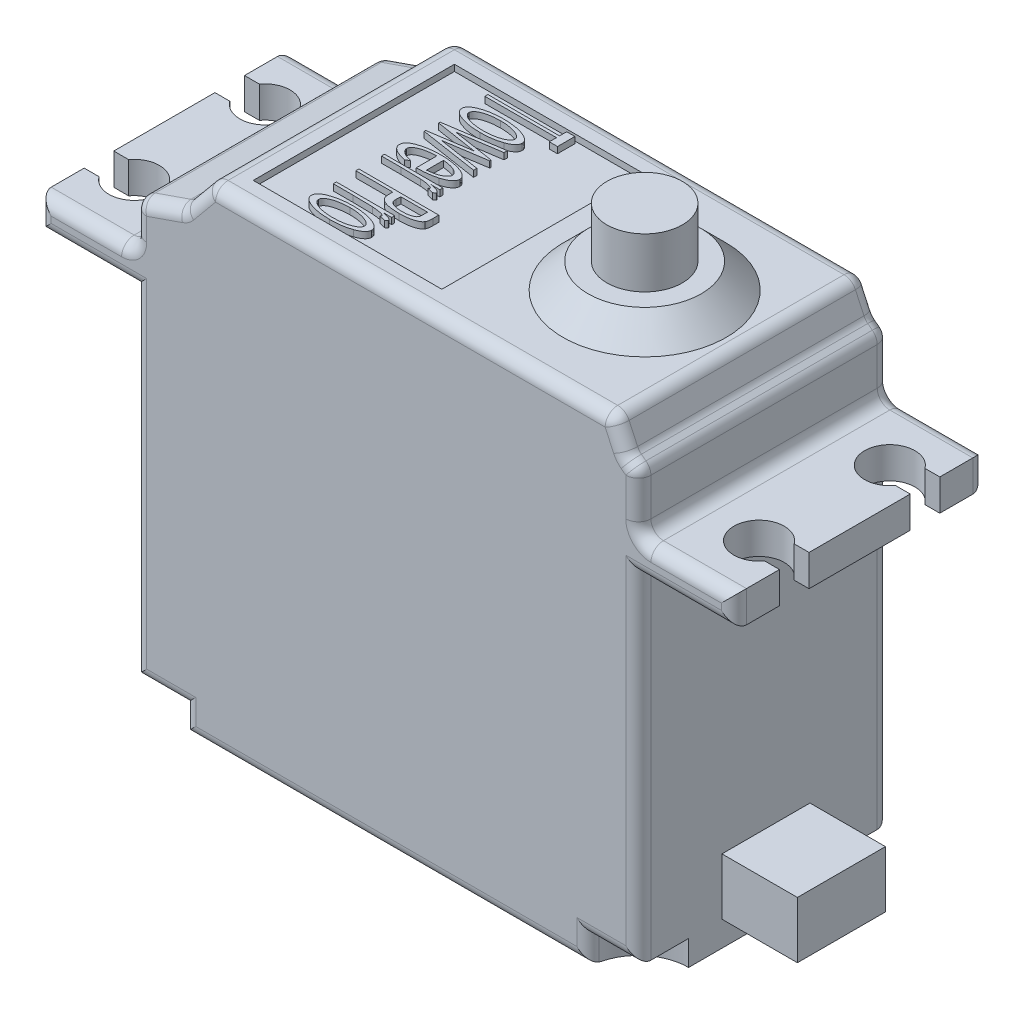
from build123d import *

# Parameters (mm, degrees)
SKETCH1_W                = 40.1
SKETCH1_H                = 20
BOSS_EXTRUDE1_DEPTH      = 38.9
SKETCH2_R                = 4
CUT_EXTRUDE1_DEPTH       = 2
SKETCH3_W                = 7
SKETCH3_H                = 4.5
BOSS_EXTRUDE2_DEPTH      = 6
BOSS_EXTRUDE3_DEPTH      = 7.6
BOSS_EXTRUDE3_DEPTH_BACK = 47.7
SKETCH4_W                = 20
SKETCH4_H                = 2.5
CUT_EXTRUDE6_DEPTH       = 3
CUT_EXTRUDE7_DEPTH       = 65.718621741
SKETCH7_R                = 6.5
BOSS_EXTRUDE4_DEPTH      = 2
SKETCH8_R                = 3
BOSS_EXTRUDE5_DEPTH      = 4
CHAMFER1_SIZE            = 2
FILLET1_R                = 1
SKETCH9_W                = 15
SKETCH9_H                = 16
CUT_EXTRUDE8_DEPTH       = 0.5
BOSS_EXTRUDE6_DEPTH      = 0.5


with BuildPart() as part:
    # Sketch1 → Boss-Extrude1 (new body)
    with BuildSketch(Plane(origin=(0, 0, 0), x_dir=(1, 0, 0), z_dir=(0, 1, 0))):
        with Locations((20.05, 10)):
            Rectangle(SKETCH1_W, SKETCH1_H)
    extrude(amount=BOSS_EXTRUDE1_DEPTH)

    # Sketch2 → Cut-Extrude1 (cut)
    with BuildSketch(Plane.XZ):
        with Locations((0, -20)):
            Circle(SKETCH2_R)
        Circle(SKETCH2_R)
        with Locations((40.1, 0)):
            Circle(SKETCH2_R)
        with Locations((40.1, -20)):
            Circle(SKETCH2_R)
    extrude(amount=-CUT_EXTRUDE1_DEPTH, mode=Mode.SUBTRACT)

    # Sketch3 → Boss-Extrude2 (add)
    with BuildSketch(Plane(origin=(40.1, 0, 0), x_dir=(0, 0, -1), z_dir=(1, 0, 0))):
        with Locations((10.15, 4.25)):
            Rectangle(SKETCH3_W, SKETCH3_H)
    extrude(amount=BOSS_EXTRUDE2_DEPTH)

    # Sketch4 → Boss-Extrude3 (add, two sides: drawn at the far end of the back side and taken through both)
    with BuildSketch(Plane(origin=(40.1, 0, 0), x_dir=(0, 0, -1), z_dir=(1, 0, 0)).offset(-BOSS_EXTRUDE3_DEPTH_BACK)):
        with Locations((10, 30.15)):
            Rectangle(SKETCH4_W, SKETCH4_H)
    extrude(amount=BOSS_EXTRUDE3_DEPTH + BOSS_EXTRUDE3_DEPTH_BACK)

    # Sketch5 → Cut-Extrude6 (cut)
    with BuildSketch(Plane(origin=(0, 31.4, 0), x_dir=(1, 0, 0), z_dir=(0, 1, 0))):
        with BuildLine():
            Line((-6.417379657, 5.976470588), (-7.6, 5.976470588))
            Line((-7.6, 5.976470588), (-7.6, 3.623529412))
            Line((-7.6, 3.623529412), (-6.417379657, 3.623529412))
            ThreePointArc((-6.417379657, 3.623529412), (-2.8, 4.8), (-6.417379657, 5.976470588))
        make_face()
        with BuildLine():
            Line((-7.6, 16.376470588), (-7.6, 14.023529412))
            Line((-7.6, 14.023529412), (-6.417379657, 14.023529412))
            ThreePointArc((-6.417379657, 14.023529412), (-2.8, 15.2), (-6.417379657, 16.376470588))
            Line((-6.417379657, 16.376470588), (-7.6, 16.376470588))
        make_face()
        with BuildLine():
            ThreePointArc((46.517379657, 14.023529412), (42.9, 15.2), (46.517379657, 16.376470588))
            Line((46.517379657, 16.376470588), (47.7, 16.376470588))
            Line((47.7, 16.376470588), (47.7, 14.023529412))
            Line((47.7, 14.023529412), (46.517379657, 14.023529412))
        make_face()
        with BuildLine():
            Line((47.7, 5.976470588), (46.517379657, 5.976470588))
            ThreePointArc((46.517379657, 5.976470588), (42.9, 4.8), (46.517379657, 3.623529412))
            Line((46.517379657, 3.623529412), (47.7, 3.623529412))
            Line((47.7, 3.623529412), (47.7, 5.976470588))
        make_face()
    extrude(amount=-CUT_EXTRUDE6_DEPTH, mode=Mode.SUBTRACT)

    # Sketch6 → Cut-Extrude7 (cut, through all)
    with BuildSketch(Plane.XY):
        Polygon((40.1, 38.9), (40.1, 35.9), (39.146440586, 36.628508369), (38.1, 38.9), align=None)
        Polygon((0, 38.9), (0, 34.9), (3.778086354, 36.213797359), (6, 38.9), align=None)
    extrude(amount=-CUT_EXTRUDE7_DEPTH, mode=Mode.SUBTRACT)

    # Sketch7 → Boss-Extrude4 (add)
    with BuildSketch(Plane(origin=(0, 38.9, 0), x_dir=(-1, 0, 0), z_dir=(0, 1, 0))):
        with Locations(Location((-30.6, -10, 0), (0, 0, 270))):
            Circle(SKETCH7_R)
    extrude(amount=BOSS_EXTRUDE4_DEPTH)

    # Sketch8 → Boss-Extrude5 (add)
    with BuildSketch(Plane(origin=(0, 40.9, 0), x_dir=(-1, 0, 0), z_dir=(0, 1, 0))):
        with Locations(Location((-30.6, -10, 0), (0, 0, 90))):
            Circle(SKETCH8_R)
    extrude(amount=BOSS_EXTRUDE5_DEPTH)

    # Chamfer1
    chamfer1_edges = [part.edges().sort_by_distance(p)[0] for p in [
        (30.6, 40.9, -3.5),
    ]]
    chamfer(chamfer1_edges, length=CHAMFER1_SIZE - 0.0001)  # a hair under: the kernel refuses the full size

    # Fillet1
    fillet1_edges = [part.edges().sort_by_distance(p)[0] for p in [
        (2, 2, -20),
        (4, 1, -20),
        (22.05, 38.9, -20),
        (40.1, 33.65, -20),
        (40.1, 33.65, 0),
        (38.1, 38.9, -10),
        (39.623220293, 36.264254185, -20),
        (40.1, 35.9, -10),
        (38.623220293, 37.764254185, -20),
        (39.146440586, 36.628508369, -10),
        (38.623220293, 37.764254185, 0),
        (39.623220293, 36.264254185, 0),
        (22.05, 38.9, 0),
        (0, 33.15, -20),
        (0, 33.15, 0),
        (4.889043177, 37.556898679, -20),
        (6, 38.9, -10),
        (1.889043177, 35.556898679, -20),
        (3.778086354, 36.213797359, -10),
        (0, 34.9, -10),
        (1.889043177, 35.556898679, 0),
        (4.889043177, 37.556898679, 0),
        (20.05, 0, 0),
        (2, 2, 0),
        (4, 1, 0),
        (36.1, 1, 0),
        (38.1, 2, 0),
        (20.05, 0, -20),
        (38.1, 2, -20),
        (36.1, 1, -20),
        (0, 15.45, -20),
        (40.1, 15.45, -20),
        (40.1, 15.45, 0),
        (0, 15.45, 0),
        (43.9, 28.9, 0),
        (-7.6, 30.15, 0),
        (-3.8, 28.9, 0),
        (43.9, 31.4, -20),
        (-7.6, 30.15, -20),
        (-3.8, 31.4, -20),
        (43.9, 31.4, 0),
        (-3.8, 31.4, 0),
        (43.9, 28.9, -20),
        (-3.8, 28.9, -20),
        (40.1, 31.4, -10),
        (0, 31.4, -10),
        (47.7, 30.15, 0),
        (47.7, 30.15, -20),
    ]]
    fillet(fillet1_edges, radius=FILLET1_R)

    # Sketch9 → Cut-Extrude8 (cut)
    with BuildSketch(Plane(origin=(0, 38.9, 0), x_dir=(-1, 0, 0), z_dir=(0, 1, 0))):
        with Locations((-14.970605647, -10)):
            Rectangle(SKETCH9_W, SKETCH9_H)
    extrude(amount=-CUT_EXTRUDE8_DEPTH, mode=Mode.SUBTRACT)

    # Sketch10 → Boss-Extrude6 (add)
    # profile 1 of 8: a face of its own
    with BuildSketch(Plane(origin=(0, 38.4, 0), x_dir=(-1, 0, 0), z_dir=(0, 1, 0))):
        with BuildLine():
            add(Edge.make_bspline(
                [(-15.609067185, -3.282381811), (-15.607111828, -3.248087251), (-15.603180704, -3.179140175), (-15.562474756, -3.080168118), (-15.501777128, -2.986177634), (-15.416386919, -2.897141186), (-15.307255469, -2.814010785), (-15.174481142, -2.735414592), (-15.018872121, -2.660118154), (-14.904772124, -2.617806185), (-14.844573996, -2.595482772)],
                knots=[0, 0, 0, 0, 0.750480752, 1.508794822, 2.318163911, 3.201857602, 4.205066968, 5.325788068, 6.589109935, 8, 8, 8, 8], degree=3))
            add(Edge.make_bspline(
                [(-14.844573996, -2.595482772), (-14.785454317, -2.57517579), (-14.665320573, -2.533911122), (-14.478143682, -2.486293662), (-14.284289647, -2.441479795), (-14.081425891, -2.408515746), (-13.871178797, -2.379717037), (-13.652516569, -2.361340803), (-13.426387932, -2.34951515), (-13.272778222, -2.348136337), (-13.194744268, -2.347435897)],
                knots=[0, 0, 0, 0, 0.894575042, 1.817815181, 2.763338534, 3.742370873, 4.758890728, 5.800938078, 6.882873379, 8, 8, 8, 8], degree=3))
            add(Edge.make_bspline(
                [(-13.194744268, -2.347435897), (-13.116282978, -2.348030617), (-12.961796706, -2.349201589), (-12.733963447, -2.362565138), (-12.513341359, -2.382826806), (-12.300136066, -2.410149605), (-12.094280592, -2.447291548), (-11.896490423, -2.49284771), (-11.705998004, -2.546685139), (-11.525231618, -2.606411463), (-11.358875094, -2.672144622), (-11.212685063, -2.744586255), (-11.088628134, -2.821602449), (-10.986211468, -2.903356488), (-10.90536203, -2.990063741), (-10.848111849, -3.082902695), (-10.812634271, -3.181106494), (-10.808120713, -3.248604656), (-10.805862057, -3.282381811)],
                knots=[0, 0, 0, 0, 1.371178853, 2.699781079, 3.987321504, 5.242966159, 6.455306528, 7.641775897, 8.789015155, 9.913895999, 10.968029035, 11.912579446, 12.761755319, 13.515219379, 14.197174364, 14.822498627, 15.410759582, 16, 16, 16, 16], degree=3))
            add(Edge.make_bspline(
                [(-10.805862057, -3.282381811), (-10.808173485, -3.316142765), (-10.812819984, -3.384010023), (-10.847790699, -3.482815117), (-10.905349887, -3.576019357), (-10.986592782, -3.662624766), (-11.08814888, -3.745873453), (-11.212764119, -3.822623466), (-11.358849826, -3.895195936), (-11.525240651, -3.960877852), (-11.705989714, -4.020661909), (-11.896514885, -4.074317364), (-12.094115157, -4.120553844), (-12.300406797, -4.154996776), (-12.513199043, -4.185077469), (-12.733987489, -4.204574844), (-12.961790389, -4.218150167), (-13.11628085, -4.219291917), (-13.194744268, -4.219871795)],
                knots=[0, 0, 0, 0, 0.588821408, 1.18366601, 1.808545603, 2.490015648, 3.247627414, 4.096199436, 5.040078174, 6.093461613, 7.21754255, 8.363966004, 9.549591671, 10.759779098, 12.015513892, 13.302138743, 14.629796197, 16, 16, 16, 16], degree=3))
            add(Edge.make_bspline(
                [(-13.194744268, -4.219871795), (-13.272354444, -4.219168131), (-13.425540578, -4.217779247), (-13.6512401, -4.205931046), (-13.869084516, -4.1877886), (-14.07843459, -4.158587801), (-14.280852461, -4.125645206), (-14.474850878, -4.081414585), (-14.661862289, -4.033147717), (-14.781628342, -3.992093665), (-14.84075789, -3.97182492)],
                knots=[0, 0, 0, 0, 1.113568755, 2.197950074, 3.242353264, 4.24910948, 5.230355196, 6.183954623, 7.10340252, 8, 8, 8, 8], degree=3))
            add(Edge.make_bspline(
                [(-14.84075789, -3.97182492), (-14.901393721, -3.949539572), (-15.015991025, -3.907421888), (-15.17250957, -3.831728784), (-15.305529525, -3.752337848), (-15.415085221, -3.668471114), (-15.501779186, -3.580279596), (-15.562776885, -3.485536674), (-15.602996253, -3.385971504), (-15.607058308, -3.316659734), (-15.609067185, -3.282381811)],
                knots=[0, 0, 0, 0, 1.41310997, 2.670674897, 3.799029526, 4.797667281, 5.683722785, 6.48940359, 7.252939179, 8, 8, 8, 8], degree=3))
        make_face()
        with BuildLine():
            add(Edge.make_bspline(
                [(-15.03919539, -3.283653846), (-15.037385907, -3.307211446), (-15.033727635, -3.354838373), (-15.006180955, -3.423795429), (-14.963532146, -3.489575561), (-14.90220099, -3.551211589), (-14.826272056, -3.612089833), (-14.732026772, -3.668760257), (-14.621852571, -3.723529242), (-14.496291015, -3.774568845), (-14.358383528, -3.820651751), (-14.21271031, -3.863278043), (-14.059030149, -3.896641369), (-13.899317401, -3.926793795), (-13.731824223, -3.947256694), (-13.558016644, -3.9646967), (-13.37671988, -3.972805412), (-13.253686576, -3.974683186), (-13.190928163, -3.975641026)],
                knots=[0, 0, 0, 0, 0.537020026, 1.085705432, 1.674077074, 2.318023423, 3.062261223, 3.892877357, 4.824182514, 5.871018303, 6.985945448, 8.144773651, 9.336135426, 10.57672083, 11.856208973, 13.189133643, 14.566197051, 16, 16, 16, 16], degree=3))
            add(Edge.make_bspline(
                [(-13.190928163, -3.975641026), (-13.109919995, -3.974210131), (-12.950281871, -3.971390351), (-12.714924833, -3.955370233), (-12.488222503, -3.925812746), (-12.272767487, -3.886025286), (-12.073501808, -3.835789358), (-11.895335599, -3.778344217), (-11.740801722, -3.712733461), (-11.611910878, -3.638356779), (-11.508388691, -3.55788316), (-11.433708833, -3.471409403), (-11.383671863, -3.380063249), (-11.378327872, -3.315158957), (-11.375733852, -3.283653846)],
                knots=[0, 0, 0, 0, 1.406122645, 2.770964778, 4.091824399, 5.37212343, 6.571589075, 7.656092665, 8.618568693, 9.479395674, 10.233363803, 10.880738082, 11.456700471, 12, 12, 12, 12], degree=3))
            add(Edge.make_bspline(
                [(-11.375733852, -3.283653846), (-11.378343531, -3.25216234), (-11.383719783, -3.187286078), (-11.433335545, -3.096000379), (-11.508910122, -3.01073381), (-11.611791957, -2.930073706), (-11.741128619, -2.856131531), (-11.894970497, -2.788564151), (-12.073565519, -2.731659892), (-12.272748381, -2.681239956), (-12.48822794, -2.641507026), (-12.714923311, -2.611934077), (-12.950282271, -2.595918229), (-13.109920129, -2.593097859), (-13.190928163, -2.591666667)],
                knots=[0, 0, 0, 0, 0.543418984, 1.11950801, 1.761435781, 2.515569685, 3.376585936, 4.342223991, 5.426966031, 6.626695402, 7.907275932, 9.22842597, 10.593568191, 12, 12, 12, 12], degree=3))
            add(Edge.make_bspline(
                [(-13.190928163, -2.591666667), (-13.253686884, -2.592623254), (-13.376720792, -2.594498573), (-13.558013209, -2.602624948), (-13.731836451, -2.620001318), (-13.899274292, -2.640689045), (-14.05927644, -2.670061522), (-14.21224153, -2.706244597), (-14.358914546, -2.745775183), (-14.496003698, -2.794466874), (-14.621857847, -2.844971216), (-14.732123534, -2.899720467), (-14.825716068, -2.956743798), (-14.903074469, -3.015984023), (-14.963141585, -3.078992907), (-15.005887611, -3.144439711), (-15.03391491, -3.212819728), (-15.037438082, -3.260080723), (-15.03919539, -3.283653846)],
                knots=[0, 0, 0, 0, 1.434283005, 2.81180747, 4.14517842, 5.425094952, 6.66609572, 7.860020677, 9.016601871, 10.135054363, 11.182240647, 12.113857616, 12.944751851, 13.683224851, 14.334416733, 14.92298537, 15.462800173, 16, 16, 16, 16], degree=3))
        make_face(mode=Mode.SUBTRACT)
    # profile 2 of 8: a face of its own
    with BuildSketch(Plane(origin=(0, 38.4, 0), x_dir=(-1, 0, 0), z_dir=(0, 1, 0))):
        with BuildLine():
            Line((-15.527656929, -5.196794872), (-15.527656929, -4.952564103))
            Line((-15.527656929, -4.952564103), (-14.844573996, -4.952564103))
            add(Edge.make_bspline(
                [(-14.844573996, -4.952564103), (-14.90748533, -4.940551424), (-15.024555176, -4.918197386), (-15.184685319, -4.876989103), (-15.317810816, -4.837539128), (-15.423619837, -4.795936855), (-15.504746915, -4.752960429), (-15.561945632, -4.708956082), (-15.600810781, -4.663011533), (-15.606466712, -4.628704369), (-15.609067185, -4.612930689)],
                knots=[0, 0, 0, 0, 1.761421786, 3.277777876, 4.5469885, 5.578007716, 6.402796696, 7.058594708, 7.567162562, 8, 8, 8, 8], degree=3))
            add(Edge.make_bspline(
                [(-15.609067185, -4.612930689), (-15.606571231, -4.600650718), (-15.600902797, -4.572762301), (-15.567012983, -4.535321924), (-15.515626773, -4.49906782), (-15.4737339, -4.476726365), (-15.450062778, -4.464102564)],
                knots=[0, 0, 0, 0, 0.654873348, 1.487249584, 2.580197173, 4, 4, 4, 4], degree=3))
            Line((-15.450062778, -4.464102564), (-14.956513099, -4.583673878))
            add(Edge.make_bspline(
                [(-14.956513099, -4.583673878), (-14.968584158, -4.591066235), (-14.990453206, -4.604458911), (-15.016708179, -4.625231732), (-15.03507124, -4.644666474), (-15.037952916, -4.65893295), (-15.03919539, -4.665084135)],
                knots=[0, 0, 0, 0, 1.415327194, 2.564137706, 3.380908414, 4, 4, 4, 4], degree=3))
            add(Edge.make_bspline(
                [(-15.03919539, -4.665084135), (-15.035215152, -4.6785491), (-15.025462266, -4.711542667), (-14.971084434, -4.747383694), (-14.895160342, -4.783701247), (-14.787161668, -4.81996478), (-14.647184039, -4.852022493), (-14.474124484, -4.880276957), (-14.267953232, -4.905759863), (-14.119155169, -4.917182784), (-14.039375679, -4.923307292)],
                knots=[0, 0, 0, 0, 0.309315145, 0.757923238, 1.387274804, 2.237985719, 3.310724258, 4.63114783, 6.193758007, 8, 8, 8, 8], degree=3))
            add(Edge.make_bspline(
                [(-14.039375679, -4.923307292), (-14.002490685, -4.925500119), (-13.91984389, -4.930413502), (-13.783738739, -4.936695447), (-13.622173419, -4.941727826), (-13.436008066, -4.94499488), (-13.22401538, -4.949282728), (-12.987407028, -4.951531822), (-12.725364902, -4.952864089), (-12.542614403, -4.952667294), (-12.446787538, -4.952564103)],
                knots=[0, 0, 0, 0, 0.556652875, 1.247270789, 2.052535074, 2.991732549, 4.052275248, 5.24685625, 6.556364347, 8, 8, 8, 8], degree=3))
            Line((-12.446787538, -4.952564103), (-10.887272313, -4.952564103))
            Line((-10.887272313, -4.952564103), (-10.887272313, -5.196794872))
            Line((-10.887272313, -5.196794872), (-15.527656929, -5.196794872))
        make_face()
    # profile 3 of 8: a face of its own
    with BuildSketch(Plane(origin=(0, 38.4, 0), x_dir=(-1, 0, 0), z_dir=(0, 1, 0))):
        with BuildLine():
            Line((-17.237272313, -6.987820513), (-17.237272313, -6.520983574))
            add(Edge.make_bspline(
                [(-17.237272313, -6.520983574), (-17.236247088, -6.459405423), (-17.234368154, -6.346550872), (-17.2168055, -6.194357629), (-17.191831076, -6.071672753), (-17.157160159, -6.007429133), (-17.141869669, -5.979096554)],
                knots=[0, 0, 0, 0, 1.327150313, 2.432274264, 3.308605093, 4, 4, 4, 4], degree=3))
            add(Edge.make_bspline(
                [(-17.141869669, -5.979096554), (-17.114760792, -5.945957077), (-17.056002246, -5.874127192), (-16.930847731, -5.788130336), (-16.772349287, -5.712605889), (-16.580994243, -5.644849151), (-16.358143815, -5.590303655), (-16.10722884, -5.54993826), (-15.829593486, -5.526077812), (-15.635404971, -5.523685138), (-15.534017105, -5.522435897)],
                knots=[0, 0, 0, 0, 0.594983836, 1.289628702, 2.093972417, 3.04272691, 4.11602617, 5.290956585, 6.585579944, 8, 8, 8, 8], degree=3))
            add(Edge.make_bspline(
                [(-15.534017105, -5.522435897), (-15.432214779, -5.523807648), (-15.23765631, -5.526429256), (-14.959572202, -5.548585873), (-14.709638056, -5.587886564), (-14.487887919, -5.639864533), (-14.296809846, -5.70619678), (-14.137873348, -5.784195511), (-14.010923963, -5.875025169), (-13.950657591, -5.950162284), (-13.922348435, -5.985456731)],
                knots=[0, 0, 0, 0, 1.412847374, 2.700148731, 3.867951888, 4.921354973, 5.857592027, 6.668210199, 7.374413232, 8, 8, 8, 8], degree=3))
            add(Edge.make_bspline(
                [(-13.922348435, -5.985456731), (-13.905759573, -6.017170889), (-13.868215297, -6.088947066), (-13.839291883, -6.222903253), (-13.820680929, -6.388520412), (-13.818975254, -6.510293115), (-13.818041544, -6.576953125)],
                knots=[0, 0, 0, 0, 0.704794633, 1.595106667, 2.683529165, 4, 4, 4, 4], degree=3))
            Line((-13.818041544, -6.576953125), (-13.818041544, -6.743589744))
            Line((-13.818041544, -6.743589744), (-10.887272313, -6.743589744))
            Line((-10.887272313, -6.743589744), (-10.887272313, -6.987820513))
            Line((-10.887272313, -6.987820513), (-17.237272313, -6.987820513))
        make_face()
        with BuildLine():
            Line((-16.585990262, -6.743589744), (-14.469323595, -6.743589744))
            Line((-14.469323595, -6.743589744), (-14.455331208, -6.351802885))
            add(Edge.make_bspline(
                [(-14.455331208, -6.351802885), (-14.456743429, -6.314813863), (-14.459401008, -6.245206348), (-14.480207087, -6.148072256), (-14.517591122, -6.066755185), (-14.570681035, -5.999585651), (-14.642005848, -5.947674265), (-14.727028876, -5.899075766), (-14.832233469, -5.862012107), (-14.951974063, -5.827828954), (-15.084657529, -5.800444948), (-15.226501246, -5.780110098), (-15.376522395, -5.768773541), (-15.478877129, -5.767381817), (-15.531473034, -5.766666667)],
                knots=[0, 0, 0, 0, 0.962294292, 1.810886345, 2.566175238, 3.27273716, 4.012140606, 4.847062878, 5.814405305, 6.904212513, 8.088009133, 9.336436513, 10.631303834, 12, 12, 12, 12], degree=3))
            add(Edge.make_bspline(
                [(-15.531473034, -5.766666667), (-15.582372653, -5.767413064), (-15.68260769, -5.768882921), (-15.829665525, -5.780034906), (-15.970263547, -5.800509194), (-16.101711737, -5.828505042), (-16.221624872, -5.859407258), (-16.323812582, -5.89952029), (-16.409462346, -5.941438498), (-16.47755576, -5.992146065), (-16.529696221, -6.05512126), (-16.561235221, -6.135063683), (-16.583968602, -6.228840711), (-16.585285871, -6.297356511), (-16.585990262, -6.333994391)],
                knots=[0, 0, 0, 0, 1.353184466, 2.664784131, 3.917864807, 5.127233935, 6.237554376, 7.204737013, 8.041677712, 8.765436878, 9.446778498, 10.183933694, 11.028883577, 12, 12, 12, 12], degree=3))
            Line((-16.585990262, -6.333994391), (-16.585990262, -6.743589744))
        make_face(mode=Mode.SUBTRACT)
    # profile 4 of 8: a face of its own
    with BuildSketch(Plane(origin=(0, 38.4, 0), x_dir=(-1, 0, 0), z_dir=(0, 1, 0))):
        with BuildLine():
            Line((-15.527656929, -9.023076923), (-15.527656929, -8.778846154))
            Line((-15.527656929, -8.778846154), (-14.844573996, -8.778846154))
            add(Edge.make_bspline(
                [(-14.844573996, -8.778846154), (-14.90748533, -8.766833476), (-15.024555176, -8.744479437), (-15.184685319, -8.703271154), (-15.317810816, -8.663821179), (-15.423619837, -8.622218906), (-15.504746915, -8.57924248), (-15.561945632, -8.535238133), (-15.600810781, -8.489293585), (-15.606466712, -8.45498642), (-15.609067185, -8.43921274)],
                knots=[0, 0, 0, 0, 1.761421786, 3.277777876, 4.5469885, 5.578007716, 6.402796696, 7.058594708, 7.567162562, 8, 8, 8, 8], degree=3))
            add(Edge.make_bspline(
                [(-15.609067185, -8.43921274), (-15.606571231, -8.42693277), (-15.600902797, -8.399044352), (-15.567012983, -8.361603975), (-15.515626773, -8.325349871), (-15.4737339, -8.303008416), (-15.450062778, -8.290384615)],
                knots=[0, 0, 0, 0, 0.654873348, 1.487249584, 2.580197173, 4, 4, 4, 4], degree=3))
            Line((-15.450062778, -8.290384615), (-14.956513099, -8.409955929))
            add(Edge.make_bspline(
                [(-14.956513099, -8.409955929), (-14.968584158, -8.417348286), (-14.990453206, -8.430740963), (-15.016708179, -8.451513783), (-15.03507124, -8.470948526), (-15.037952916, -8.485215001), (-15.03919539, -8.491366186)],
                knots=[0, 0, 0, 0, 1.415327194, 2.564137706, 3.380908414, 4, 4, 4, 4], degree=3))
            add(Edge.make_bspline(
                [(-15.03919539, -8.491366186), (-15.035215152, -8.504831151), (-15.025462266, -8.537824719), (-14.971084434, -8.573665745), (-14.895160342, -8.609983298), (-14.787161668, -8.646246831), (-14.647184039, -8.678304545), (-14.474124484, -8.706559008), (-14.267953232, -8.732041914), (-14.119155169, -8.743464835), (-14.039375679, -8.749589343)],
                knots=[0, 0, 0, 0, 0.309315145, 0.757923238, 1.387274804, 2.237985719, 3.310724258, 4.63114783, 6.193758007, 8, 8, 8, 8], degree=3))
            add(Edge.make_bspline(
                [(-14.039375679, -8.749589343), (-14.002490685, -8.75178217), (-13.91984389, -8.756695554), (-13.783738739, -8.762977498), (-13.622173419, -8.768009877), (-13.436008066, -8.771276931), (-13.22401538, -8.77556478), (-12.987407028, -8.777813873), (-12.725364902, -8.77914614), (-12.542614403, -8.778949345), (-12.446787538, -8.778846154)],
                knots=[0, 0, 0, 0, 0.556652875, 1.247270789, 2.052535074, 2.991732549, 4.052275248, 5.24685625, 6.556364347, 8, 8, 8, 8], degree=3))
            Line((-12.446787538, -8.778846154), (-10.887272313, -8.778846154))
            Line((-10.887272313, -8.778846154), (-10.887272313, -9.023076923))
            Line((-10.887272313, -9.023076923), (-15.527656929, -9.023076923))
        make_face()
    # profile 5 of 8: a face of its own
    with BuildSketch(Plane(origin=(0, 38.4, 0), x_dir=(-1, 0, 0), z_dir=(0, 1, 0))):
        with BuildLine():
            Line((-12.352656929, -9.622205529), (-12.08680156, -9.430128205))
            add(Edge.make_bspline(
                [(-12.08680156, -9.430128205), (-12.015833295, -9.446018021), (-11.880403906, -9.476340701), (-11.689342215, -9.52976827), (-11.519630559, -9.586386635), (-11.37049728, -9.647766919), (-11.240551519, -9.712624496), (-11.126263237, -9.779976099), (-11.030082109, -9.853333096), (-10.949650806, -9.930134191), (-10.88546763, -10.011339771), (-10.839071812, -10.098073718), (-10.810713389, -10.191187756), (-10.807495441, -10.255059562), (-10.805862057, -10.287479968)],
                knots=[0, 0, 0, 0, 1.584267756, 3.023272646, 4.320357676, 5.480093781, 6.533597927, 7.482604106, 8.365794159, 9.162841749, 9.900152875, 10.610943882, 11.294935196, 12, 12, 12, 12], degree=3))
            add(Edge.make_bspline(
                [(-10.805862057, -10.287479968), (-10.807979755, -10.323400188), (-10.812190229, -10.394817887), (-10.849223173, -10.497955705), (-10.907065123, -10.594801456), (-10.990677151, -10.683208879), (-11.093925971, -10.767646216), (-11.222221168, -10.843059697), (-11.37149937, -10.914327704), (-11.541362519, -10.977398459), (-11.725399072, -11.032949134), (-11.917227164, -11.084723743), (-12.115722039, -11.126027287), (-12.320318536, -11.160223319), (-12.530211423, -11.18865181), (-12.746716489, -11.207242619), (-12.968612788, -11.219026987), (-13.118830862, -11.220439849), (-13.194744268, -11.221153846)],
                knots=[0, 0, 0, 0, 0.624277978, 1.241208924, 1.887533819, 2.577975957, 3.35007288, 4.205511337, 5.164023666, 6.23043094, 7.359394426, 8.513708469, 9.691994279, 10.891044432, 12.128441753, 13.38219141, 14.677078168, 16, 16, 16, 16], degree=3))
            add(Edge.make_bspline(
                [(-13.194744268, -11.221153846), (-13.335640061, -11.219126748), (-13.610422202, -11.215173398), (-14.010203006, -11.172463487), (-14.387865846, -11.109485592), (-14.627125634, -11.041807232), (-14.744083211, -11.008723958)],
                knots=[0, 0, 0, 0, 1.076852822, 2.100133137, 3.07128638, 4, 4, 4, 4], degree=3))
            add(Edge.make_bspline(
                [(-14.744083211, -11.008723958), (-14.811849594, -10.986369888), (-14.940067528, -10.944074687), (-15.116690269, -10.869330692), (-15.26692184, -10.788451197), (-15.390456516, -10.70126204), (-15.487107234, -10.607650009), (-15.556979391, -10.508014253), (-15.600653376, -10.401115325), (-15.606276766, -10.326867195), (-15.609067185, -10.290024038)],
                knots=[0, 0, 0, 0, 1.428732151, 2.703244262, 3.83574502, 4.839709966, 5.722431969, 6.516243836, 7.263735532, 8, 8, 8, 8], degree=3))
            add(Edge.make_bspline(
                [(-15.609067185, -10.290024038), (-15.606527524, -10.251833443), (-15.601421498, -10.175050707), (-15.553834201, -10.065159839), (-15.481060301, -9.961432703), (-15.377405621, -9.866713952), (-15.248496844, -9.775199382), (-15.089408578, -9.692911241), (-14.902799831, -9.61540772), (-14.767343468, -9.571588712), (-14.695745871, -9.548427484)],
                knots=[0, 0, 0, 0, 0.727876854, 1.463406776, 2.25601577, 3.140170036, 4.13560807, 5.27575659, 6.560058178, 8, 8, 8, 8], degree=3))
            add(Edge.make_bspline(
                [(-14.695745871, -9.548427484), (-14.64031282, -9.532748445), (-14.527078114, -9.500720416), (-14.350766949, -9.459446157), (-14.164072413, -9.427568801), (-13.967690359, -9.399536961), (-13.761630292, -9.375960974), (-13.545117601, -9.361925114), (-13.318665718, -9.350930631), (-13.164230181, -9.349466025), (-13.085349236, -9.348717949)],
                knots=[0, 0, 0, 0, 0.849111993, 1.734505769, 2.667525307, 3.639806985, 4.658548137, 5.723702702, 6.837337017, 8, 8, 8, 8], degree=3))
            Line((-13.085349236, -9.348717949), (-13.085349236, -10.976923077))
            add(Edge.make_bspline(
                [(-13.085349236, -10.976923077), (-13.024274542, -10.975636305), (-12.90459427, -10.973114782), (-12.729429022, -10.962506336), (-12.562398391, -10.948605931), (-12.404903913, -10.924279119), (-12.254988018, -10.899037595), (-12.114277368, -10.86412038), (-11.981443397, -10.824600167), (-11.857700197, -10.781377905), (-11.746311705, -10.731562), (-11.647600133, -10.680348042), (-11.564362743, -10.624387845), (-11.496487255, -10.565859592), (-11.442076301, -10.505618375), (-11.404683776, -10.440520795), (-11.38025809, -10.372709034), (-11.377226901, -10.3258335), (-11.375733852, -10.302744391)],
                knots=[0, 0, 0, 0, 1.489462585, 2.918709407, 4.27885507, 5.574390949, 6.8034442, 7.984593712, 9.106655975, 10.182610202, 11.177837617, 12.079807314, 12.891375891, 13.616985018, 14.261858353, 14.859495875, 15.438230967, 16, 16, 16, 16], degree=3))
            add(Edge.make_bspline(
                [(-11.375733852, -10.302744391), (-11.376930941, -10.280132392), (-11.37937295, -10.234004889), (-11.400758016, -10.166030991), (-11.436445166, -10.099814668), (-11.485080285, -10.036101374), (-11.543110871, -9.973835995), (-11.611581238, -9.916677564), (-11.687560719, -9.862819312), (-11.776582641, -9.814485671), (-11.883476219, -9.767735405), (-12.014749886, -9.71984422), (-12.174235334, -9.670883757), (-12.290228504, -9.639237688), (-12.352656929, -9.622205529)],
                knots=[0, 0, 0, 0, 0.639850257, 1.305266909, 1.998853267, 2.763283208, 3.571082505, 4.406746611, 5.287030616, 6.206957073, 7.272342623, 8.591893088, 10.165730393, 12, 12, 12, 12], degree=3))
        make_face()
        with BuildLine():
            add(Edge.make_bspline(
                [(-13.655221031, -9.592948718), (-13.730319451, -9.601422258), (-13.872335074, -9.617446233), (-14.073937049, -9.646860411), (-14.250794441, -9.685089004), (-14.406530884, -9.727037384), (-14.543139255, -9.774989713), (-14.663675413, -9.832309084), (-14.772825219, -9.892990506), (-14.864945894, -9.964132721), (-14.940453046, -10.038454516), (-14.997614313, -10.115025117), (-15.031555275, -10.196254321), (-15.036690808, -10.251589129), (-15.03919539, -10.278575721)],
                knots=[0, 0, 0, 0, 1.646628025, 3.113872499, 4.436580029, 5.586317233, 6.626588306, 7.585403853, 8.491782831, 9.341746527, 10.112568178, 10.794506818, 11.412085181, 12, 12, 12, 12], degree=3))
            add(Edge.make_bspline(
                [(-15.03919539, -10.278575721), (-15.038075309, -10.300786813), (-15.035829621, -10.345318601), (-15.014003253, -10.410276255), (-14.978941367, -10.472336748), (-14.929026257, -10.530786184), (-14.868145114, -10.588289808), (-14.792319546, -10.641949559), (-14.703720099, -10.693734013), (-14.638355046, -10.724322276), (-14.604159333, -10.740324519)],
                knots=[0, 0, 0, 0, 0.79300787, 1.589928988, 2.425939878, 3.331673998, 4.330453274, 5.417503817, 6.648967688, 8, 8, 8, 8], degree=3))
            add(Edge.make_bspline(
                [(-14.604159333, -10.740324519), (-14.576328329, -10.752182517), (-14.518012486, -10.777029236), (-14.423554376, -10.80747717), (-14.320210261, -10.839467617), (-14.205649652, -10.864029459), (-14.082432258, -10.892492842), (-13.948771175, -10.913797041), (-13.805648364, -10.936450451), (-13.706577021, -10.948025987), (-13.655221031, -10.954026442)],
                knots=[0, 0, 0, 0, 0.743477533, 1.557849626, 2.438655533, 3.402211026, 4.436973059, 5.547684303, 6.728783754, 8, 8, 8, 8], degree=3))
            Line((-13.655221031, -10.954026442), (-13.655221031, -9.592948718))
        make_face(mode=Mode.SUBTRACT)
    # profile 6 of 8: a face of its own
    with BuildSketch(Plane(origin=(0, 38.4, 0), x_dir=(-1, 0, 0), z_dir=(0, 1, 0))):
        Polygon((-15.527656929, -14.151923077), (-15.527656929, -13.887339744), (-12.189836416, -13.378525641), (-15.527656929, -12.860807292), (-15.527656929, -12.75141226), (-12.189836416, -12.238782051), (-15.527656929, -11.724879808), (-15.527656929, -11.465384615), (-10.887272313, -12.178996394), (-10.887272313, -12.296023638), (-14.225092826, -12.808653846), (-10.887272313, -13.326372196), (-10.887272313, -13.443399439), align=None)
    # profile 7 of 8: a face of its own
    with BuildSketch(Plane(origin=(0, 38.4, 0), x_dir=(-1, 0, 0), z_dir=(0, 1, 0))):
        with BuildLine():
            add(Edge.make_bspline(
                [(-15.609067185, -15.249689503), (-15.607111828, -15.215394944), (-15.603180704, -15.146447867), (-15.562474756, -15.047475811), (-15.501777128, -14.953485326), (-15.416386919, -14.864448878), (-15.307255469, -14.781318477), (-15.174481142, -14.702722285), (-15.018872121, -14.627425847), (-14.904772124, -14.585113878), (-14.844573996, -14.562790465)],
                knots=[0, 0, 0, 0, 0.750480752, 1.508794822, 2.318163911, 3.201857602, 4.205066968, 5.325788068, 6.589109935, 8, 8, 8, 8], degree=3))
            add(Edge.make_bspline(
                [(-14.844573996, -14.562790465), (-14.785454317, -14.542483482), (-14.665320573, -14.501218815), (-14.478143682, -14.453601355), (-14.284289647, -14.408787487), (-14.081425891, -14.375823439), (-13.871178797, -14.347024729), (-13.652516569, -14.328648496), (-13.426387932, -14.316822842), (-13.272778222, -14.315444029), (-13.194744268, -14.31474359)],
                knots=[0, 0, 0, 0, 0.894575042, 1.817815181, 2.763338534, 3.742370873, 4.758890728, 5.800938078, 6.882873379, 8, 8, 8, 8], degree=3))
            add(Edge.make_bspline(
                [(-13.194744268, -14.31474359), (-13.116282978, -14.315338309), (-12.961796706, -14.316509281), (-12.733963447, -14.32987283), (-12.513341359, -14.350134498), (-12.300136066, -14.377457297), (-12.094280592, -14.41459924), (-11.896490423, -14.460155403), (-11.705998004, -14.513992831), (-11.525231618, -14.573719155), (-11.358875094, -14.639452314), (-11.212685063, -14.711893948), (-11.088628134, -14.788910141), (-10.986211468, -14.870664181), (-10.90536203, -14.957371433), (-10.848111849, -15.050210388), (-10.812634271, -15.148414186), (-10.808120713, -15.215912349), (-10.805862057, -15.249689503)],
                knots=[0, 0, 0, 0, 1.371178853, 2.699781079, 3.987321504, 5.242966159, 6.455306528, 7.641775897, 8.789015155, 9.913895999, 10.968029035, 11.912579446, 12.761755319, 13.515219379, 14.197174364, 14.822498627, 15.410759582, 16, 16, 16, 16], degree=3))
            add(Edge.make_bspline(
                [(-10.805862057, -15.249689503), (-10.808173485, -15.283450458), (-10.812819984, -15.351317715), (-10.847790699, -15.450122809), (-10.905349887, -15.54332705), (-10.986592782, -15.629932458), (-11.08814888, -15.713181145), (-11.212764119, -15.789931158), (-11.358849826, -15.862503628), (-11.525240651, -15.928185544), (-11.705989714, -15.987969601), (-11.896514885, -16.041625056), (-12.094115157, -16.087861536), (-12.300406797, -16.122304468), (-12.513199043, -16.152385162), (-12.733987489, -16.171882537), (-12.961790389, -16.18545786), (-13.11628085, -16.186599609), (-13.194744268, -16.187179487)],
                knots=[0, 0, 0, 0, 0.588821408, 1.18366601, 1.808545603, 2.490015648, 3.247627414, 4.096199436, 5.040078174, 6.093461613, 7.21754255, 8.363966004, 9.549591671, 10.759779098, 12.015513892, 13.302138743, 14.629796197, 16, 16, 16, 16], degree=3))
            add(Edge.make_bspline(
                [(-13.194744268, -16.187179487), (-13.272354444, -16.186475824), (-13.425540578, -16.18508694), (-13.6512401, -16.173238738), (-13.869084516, -16.155096292), (-14.07843459, -16.125895493), (-14.280852461, -16.092952899), (-14.474850878, -16.048722277), (-14.661862289, -16.00045541), (-14.781628342, -15.959401357), (-14.84075789, -15.939132612)],
                knots=[0, 0, 0, 0, 1.113568755, 2.197950074, 3.242353264, 4.24910948, 5.230355196, 6.183954623, 7.10340252, 8, 8, 8, 8], degree=3))
            add(Edge.make_bspline(
                [(-14.84075789, -15.939132612), (-14.901393721, -15.916847264), (-15.015991025, -15.87472958), (-15.17250957, -15.799036476), (-15.305529525, -15.71964554), (-15.415085221, -15.635778806), (-15.501779186, -15.547587288), (-15.562776885, -15.452844367), (-15.602996253, -15.353279196), (-15.607058308, -15.283967426), (-15.609067185, -15.249689503)],
                knots=[0, 0, 0, 0, 1.41310997, 2.670674897, 3.799029526, 4.797667281, 5.683722785, 6.48940359, 7.252939179, 8, 8, 8, 8], degree=3))
        make_face()
        with BuildLine():
            add(Edge.make_bspline(
                [(-15.03919539, -15.250961538), (-15.037385907, -15.274519138), (-15.033727635, -15.322146065), (-15.006180955, -15.391103122), (-14.963532146, -15.456883254), (-14.90220099, -15.518519281), (-14.826272056, -15.579397525), (-14.732026772, -15.63606795), (-14.621852571, -15.690836934), (-14.496291015, -15.741876537), (-14.358383528, -15.787959443), (-14.21271031, -15.830585735), (-14.059030149, -15.863949061), (-13.899317401, -15.894101487), (-13.731824223, -15.914564386), (-13.558016644, -15.932004393), (-13.37671988, -15.940113105), (-13.253686576, -15.941990879), (-13.190928163, -15.942948718)],
                knots=[0, 0, 0, 0, 0.537020026, 1.085705432, 1.674077074, 2.318023423, 3.062261223, 3.892877357, 4.824182514, 5.871018303, 6.985945448, 8.144773651, 9.336135426, 10.57672083, 11.856208973, 13.189133643, 14.566197051, 16, 16, 16, 16], degree=3))
            add(Edge.make_bspline(
                [(-13.190928163, -15.942948718), (-13.109919995, -15.941517824), (-12.950281871, -15.938698043), (-12.714924833, -15.922677926), (-12.488222503, -15.893120439), (-12.272767487, -15.853332979), (-12.073501808, -15.80309705), (-11.895335599, -15.74565191), (-11.740801722, -15.680041154), (-11.611910878, -15.605664471), (-11.508388691, -15.525190852), (-11.433708833, -15.438717095), (-11.383671863, -15.347370942), (-11.378327872, -15.28246665), (-11.375733852, -15.250961538)],
                knots=[0, 0, 0, 0, 1.406122645, 2.770964778, 4.091824399, 5.37212343, 6.571589075, 7.656092665, 8.618568693, 9.479395674, 10.233363803, 10.880738082, 11.456700471, 12, 12, 12, 12], degree=3))
            add(Edge.make_bspline(
                [(-11.375733852, -15.250961538), (-11.378343531, -15.219470033), (-11.383719783, -15.15459377), (-11.433335545, -15.063308072), (-11.508910122, -14.978041503), (-11.611791957, -14.897381398), (-11.741128619, -14.823439223), (-11.894970497, -14.755871843), (-12.073565519, -14.698967584), (-12.272748381, -14.648547649), (-12.48822794, -14.608814718), (-12.714923311, -14.579241769), (-12.950282271, -14.563225921), (-13.109920129, -14.560405552), (-13.190928163, -14.558974359)],
                knots=[0, 0, 0, 0, 0.543418984, 1.11950801, 1.761435781, 2.515569685, 3.376585936, 4.342223991, 5.426966031, 6.626695402, 7.907275932, 9.22842597, 10.593568191, 12, 12, 12, 12], degree=3))
            add(Edge.make_bspline(
                [(-13.190928163, -14.558974359), (-13.253686884, -14.559930946), (-13.376720792, -14.561806266), (-13.558013209, -14.569932641), (-13.731836451, -14.587309011), (-13.899274292, -14.607996737), (-14.05927644, -14.637369215), (-14.21224153, -14.673552289), (-14.358914546, -14.713082875), (-14.496003698, -14.761774567), (-14.621857847, -14.812278909), (-14.732123534, -14.867028159), (-14.825716068, -14.92405149), (-14.903074469, -14.983291716), (-14.963141585, -15.0463006), (-15.005887611, -15.111747403), (-15.03391491, -15.180127421), (-15.037438082, -15.227388416), (-15.03919539, -15.250961538)],
                knots=[0, 0, 0, 0, 1.434283005, 2.81180747, 4.14517842, 5.425094952, 6.66609572, 7.860020677, 9.016601871, 10.135054363, 11.182240647, 12.113857616, 12.944751851, 13.683224851, 14.334416733, 14.92298537, 15.462800173, 16, 16, 16, 16], degree=3))
        make_face(mode=Mode.SUBTRACT)
    # profile 8 of 8: a face of its own
    with BuildSketch(Plane(origin=(0, 38.4, 0), x_dir=(-1, 0, 0), z_dir=(0, 1, 0))):
        Polygon((-16.585990262, -17.815384615), (-17.237272313, -17.815384615), (-17.237272313, -16.431410256), (-16.585990262, -16.431410256), (-16.585990262, -17.001282051), (-10.887272313, -17.001282051), (-10.887272313, -17.245512821), (-16.585990262, -17.245512821), align=None)
    extrude(amount=BOSS_EXTRUDE6_DEPTH)


solid = part.part
